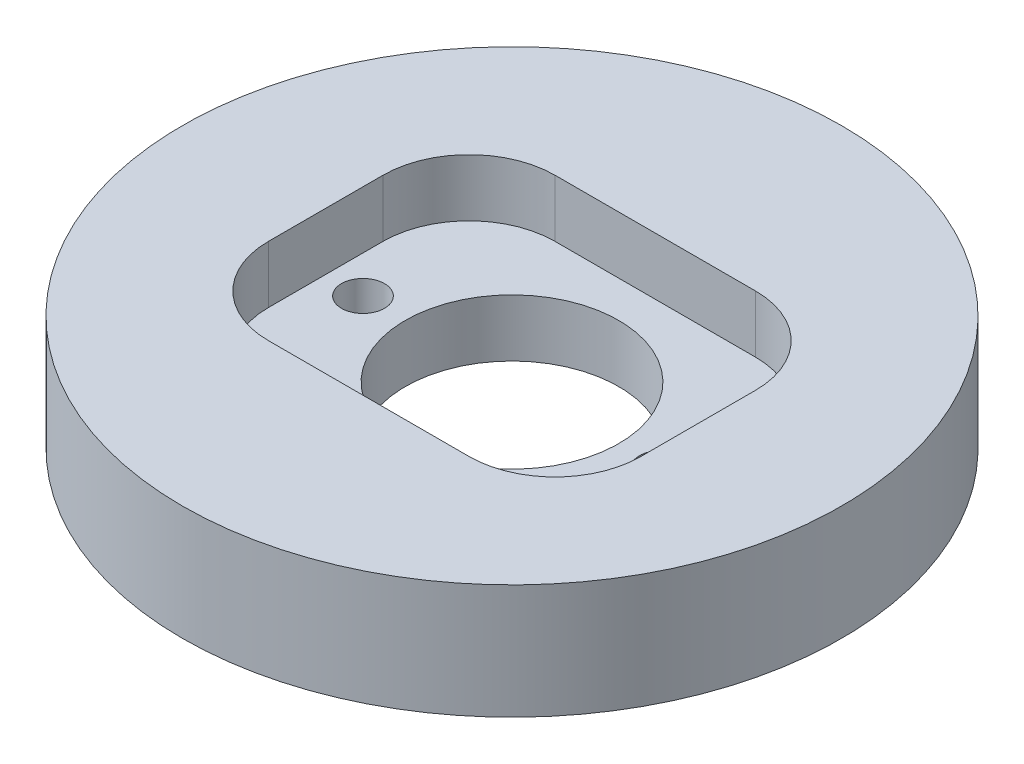
from build123d import *

# Parameters (mm, degrees)
SKETCH2_R           = 11.5
BOSS_EXTRUDE1_DEPTH = 4
SKETCH3_W           = 13
SKETCH3_H           = 10
CUT_EXTRUDE1_DEPTH  = 2
FILLET1_R           = 3
SKETCH4_R           = 3.725
SKETCH4_R_2         = 0.75
CUT_EXTRUDE2_DEPTH  = 17.385969608


with BuildPart() as part:
    # Sketch2 → Boss-Extrude1 (new body)
    with BuildSketch(Plane(origin=(0, 0, 0), x_dir=(1, 0, 0), z_dir=(0, 1, 0))):
        Circle(SKETCH2_R)
    extrude(amount=BOSS_EXTRUDE1_DEPTH)

    # Sketch3 → Cut-Extrude1 (cut)
    with BuildSketch(Plane(origin=(0, 4, 0), x_dir=(1, 0, 0), z_dir=(0, 1, 0))):
        Rectangle(SKETCH3_W, SKETCH3_H)
    extrude(amount=-CUT_EXTRUDE1_DEPTH, mode=Mode.SUBTRACT)

    # Fillet1
    fillet1_edges = [part.edges().sort_by_distance(p)[0] for p in [
        (-6.5, 3, 5),
        (6.5, 3, 5),
        (-6.5, 3, -5),
        (6.5, 3, -5),
    ]]
    fillet(fillet1_edges, radius=FILLET1_R)

    # Sketch4 → Cut-Extrude2 (cut, through all)
    with BuildSketch(Plane(origin=(0, 2, 0), x_dir=(1, 0, 0), z_dir=(0, 1, 0))):
        Circle(SKETCH4_R)
        with Locations((-5.2, 0)):
            Circle(SKETCH4_R_2)
        with Locations((5.2, 0)):
            Circle(SKETCH4_R_2)
    extrude(amount=-CUT_EXTRUDE2_DEPTH, mode=Mode.SUBTRACT)


solid = part.part
